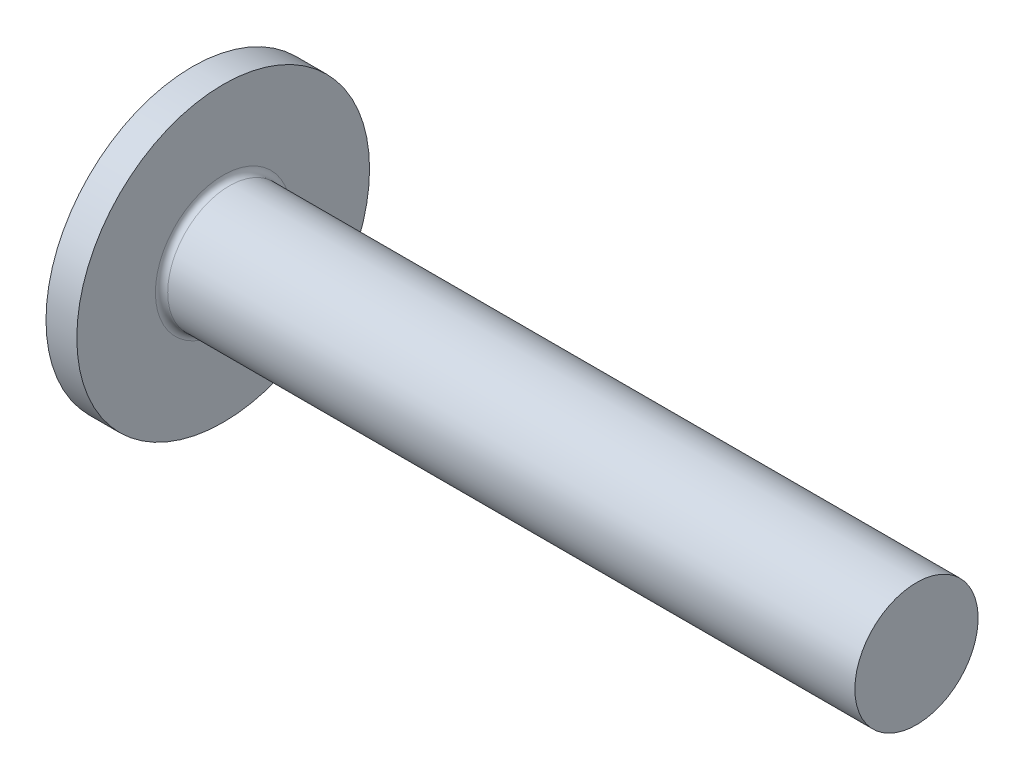
from build123d import *

# Parameters (mm, degrees)
FILLET1_R    = 0.4
RECPAT_COUNT = 2
RECPAT_ANGLE = 90


with BuildPart() as part:
    # BodySke → Base-Revolve (revolve)
    with BuildSketch(Plane.XY):
        Polygon((5.9, 4), (5.9, 9.5), (3.9, 9.5), (3.9, 0), (50.9, 0), (50.9, 4), align=None)
    revolve(axis=Axis((-6.35, 0, 0), (1, 0, 0)))

    # Fillet1
    fillet1_edges = [part.edges().sort_by_distance(p)[0] for p in [
        (5.9, -4, 0),
    ]]
    fillet(fillet1_edges, radius=FILLET1_R)

    # PanSke → Pan (revolve)
    with BuildSketch(Plane.XY):
        with BuildLine():
            Line((3.9, 8.401785525), (3.9, 0))
            Line((3.9, 0), (0, 0))
            ThreePointArc((0, 0), (1.02252537, 4.631414471), (3.9, 8.401785525))
        make_face()
    revolve(axis=Axis((0, 0, 0), (1, 0, 0)))

    # Sketch3 → Recess section 0
    with BuildSketch(Plane(origin=(0, 0, 0), x_dir=(0, 0, -1), z_dir=(1, 0, 0))):
        with BuildLine():
            Line((-1.08, 4.4), (1.08, 4.4))
            Line((1.08, 4.4), (1.08, -4.4))
            Line((1.08, -4.4), (-1.08, -4.4))
            Line((-1.08, -4.4), (-1.08, 4.4))
        make_face()
    # Sketch4 → Recess section 1
    with BuildSketch(Plane(origin=(4.52, 0, 0), x_dir=(0, 0, -1), z_dir=(1, 0, 0))):
        with BuildLine():
            Line((-1.08, 2.106524682), (1.08, 2.106524682))
            Line((1.08, 2.106524682), (1.08, -2.106524682))
            Line((1.08, -2.106524682), (-1.08, -2.106524682))
            Line((-1.08, -2.106524682), (-1.08, 2.106524682))
        make_face()
    recess = loft(mode=Mode.SUBTRACT)

    # RecPat: Recess ×2 about axis
    recpat_axis = Axis((0, 0, 0), (1, 0, 0))
    for i in range(1, RECPAT_COUNT):
        add(recess.rotate(recpat_axis, i * RECPAT_ANGLE / (RECPAT_COUNT - 1)), mode=Mode.SUBTRACT)

    # RecCorSke → RecessCore (revolve, cut)
    with BuildSketch(Plane.XY):
        Polygon((0, 0), (0, 2.252163335), (4.6, 1.9305), (5.227257474, 0), align=None)
    revolve(axis=Axis((-3.175, 0, 0), (1, 0, 0)), mode=Mode.SUBTRACT)


solid = part.part
